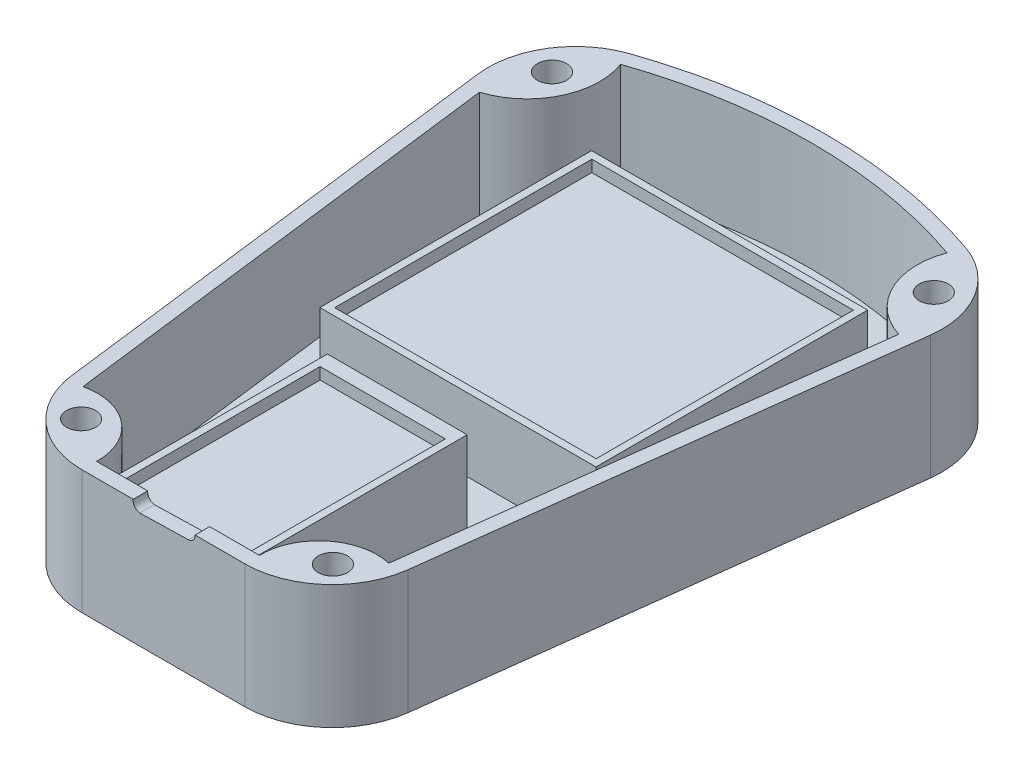
from build123d import *

# Parameters (mm, degrees)
BOSS_EXTRUDE1_DEPTH = 15
SHELL1_T            = 2
BOSS_EXTRUDE2_DEPTH = 15
SKETCH4_R           = 2
CUT_EXTRUDE3_DEPTH  = 17
SKETCH5_W           = 37.9
SKETCH5_H           = 37.3
BOSS_EXTRUDE3_DEPTH = 10
SKETCH8_W           = 35.9
SKETCH8_H           = 35.3
CUT_EXTRUDE4_DEPTH  = 1.6
SKETCH9_W           = 19.2
SKETCH9_H           = 30
BOSS_EXTRUDE5_DEPTH = 13.6
SKETCH11_W          = 17.2
SKETCH11_H          = 28
CUT_EXTRUDE7_DEPTH  = 1.6
CUT_EXTRUDE8_DEPTH  = 2


# Read off the part's stored shape, not the designer's step: Boss-Extrude2
with BuildPart() as part:
    # Sketch2 → Boss-Extrude1 (new body)
    with BuildSketch(Plane(origin=(0, 0, 0), x_dir=(1, 0, 0), z_dir=(0, 1, 0))):
        with BuildLine():
            Line((-29.057488174, 43.856363161), (-21.094956582, -19.84388958))
            ThreePointArc((-21.094956582, -19.84388958), (-17.790203447, -26.100323992), (-11.172177815, -28.603542234))
            Line((-11.172177815, -28.603542234), (11.172177815, -28.603542234))
            ThreePointArc((11.172177815, -28.603542234), (17.790203447, -26.100323992), (21.094956582, -19.84388958))
            Line((21.094956582, -19.84388958), (29.057488174, 43.856363161))
            ThreePointArc((29.057488174, 43.856363161), (27.625040268, 50.380107319), (22.404958564, 54.546867672))
            ThreePointArc((22.404958564, 54.546867672), (0, 58.313921904), (-22.404958564, 54.546867672))
            ThreePointArc((-22.404958564, 54.546867672), (-27.625040268, 50.380107319), (-29.057488174, 43.856363161))
        make_face()
    extrude(amount=BOSS_EXTRUDE1_DEPTH)

    # Shell1
    shell1_openings = [part.faces().sort_by_distance(p)[0] for p in [
        (0, 15, -16.825507136),
    ]]
    offset(amount=SHELL1_T, openings=shell1_openings, kind=Kind.INTERSECTION)

    # Boss-Extrude2 outline → Boss-Extrude2 (add)
    with BuildSketch(Plane(origin=(0, 0, 0), x_dir=(1, 0, 0), z_dir=(0, 1, 0))):
        with BuildLine():
            ThreePointArc((11.172177815, -28.603542234), (17.478052637, -26.364724021), (20.960385979, -20.65073078))
            ThreePointArc((20.960385979, -20.65073078), (14.125965093, -22.239021953), (11.172177815, -28.603542234))
        make_face()
        with BuildLine():
            ThreePointArc((22.404958564, 54.546867672), (22.805580573, 46.686663567), (28.769287815, 41.550760286))
            Line((28.769287815, 41.550760286), (29.057488174, 43.856363161))
            ThreePointArc((29.057488174, 43.856363161), (27.625040268, 50.380107319), (22.404958564, 54.546867672))
        make_face()
        with BuildLine():
            ThreePointArc((-11.172177815, -28.603542234), (-14.125965093, -22.239021953), (-20.960385978, -20.65073078))
            ThreePointArc((-20.960385978, -20.65073078), (-17.478052637, -26.364724021), (-11.172177815, -28.603542234))
        make_face()
        with BuildLine():
            Line((-29.057488174, 43.856363161), (-28.769287815, 41.550760286))
            ThreePointArc((-28.769287815, 41.550760286), (-22.805580573, 46.686663567), (-22.404958564, 54.546867672))
            ThreePointArc((-22.404958564, 54.546867672), (-27.625040268, 50.380107319), (-29.057488174, 43.856363161))
        make_face()
    extrude(amount=BOSS_EXTRUDE2_DEPTH)

    # Sketch4 → Cut-Extrude3 (cut)
    with BuildSketch(Plane(origin=(0, 15, 0), x_dir=(1, 0, 0), z_dir=(0, 1, 0))):
        with Locations(Location((-26.203765036, 48.932847943, 0), (0, 0, 270))):
            Circle(SKETCH4_R)
        with Locations(Location((-17.279655559, -24.618760567, 0), (0, 0, 270))):
            Circle(SKETCH4_R)
        with Locations(Location((17.279655559, -24.618760567, 0), (0, 0, 270))):
            Circle(SKETCH4_R)
        with Locations(Location((26.203765036, 48.932847943, 0), (0, 0, 270))):
            Circle(SKETCH4_R)
    extrude(amount=-CUT_EXTRUDE3_DEPTH, mode=Mode.SUBTRACT)

    # Sketch5 → Boss-Extrude3 (add)
    with BuildSketch(Plane(origin=(-2.134010057, 0, 0), x_dir=(1, 0, 0), z_dir=(0, 1, 0))):
        with Locations((1.95, 28.65)):
            Rectangle(SKETCH5_W, SKETCH5_H)
    extrude(amount=BOSS_EXTRUDE3_DEPTH)

    # Sketch8 → Cut-Extrude4 (cut)
    with BuildSketch(Plane(origin=(48.898344446, 10, 0), x_dir=(1, 0, 0), z_dir=(0, 1, 0))):
        with Locations((-49.05, 28.65)):
            Rectangle(SKETCH8_W, SKETCH8_H)
    extrude(amount=-CUT_EXTRUDE4_DEPTH, mode=Mode.SUBTRACT)

    # Sketch9 → Boss-Extrude5 (add)
    with BuildSketch(Plane(origin=(0, 0, 0), x_dir=(1, 0, 0), z_dir=(0, 1, 0))):
        with Locations((0.1, -13.603542234)):
            Rectangle(SKETCH9_W, SKETCH9_H)
    extrude(amount=BOSS_EXTRUDE5_DEPTH)

    # Sketch11 → Cut-Extrude7 (cut)
    with BuildSketch(Plane(origin=(0, 13.6, 0), x_dir=(1, 0, 0), z_dir=(0, 1, 0))):
        with Locations((0.1, -14.603542234)):
            Rectangle(SKETCH11_W, SKETCH11_H)
    extrude(amount=-CUT_EXTRUDE7_DEPTH, mode=Mode.SUBTRACT)

    # Sketch12 → Cut-Extrude8 (cut)
    with BuildSketch(Plane.XY.offset(30.603542234)):
        with BuildLine():
            Line((-4.15, 15), (4.35, 15))
            ThreePointArc((4.35, 15), (4.110077828, 14.306431155), (3.45, 13.985654515))
            Line((3.45, 13.985654515), (-3.25, 13.821910042))
            ThreePointArc((-3.25, 13.821910042), (-3.943990419, 14.224558918), (-4.15, 15))
        make_face()
    extrude(amount=-CUT_EXTRUDE8_DEPTH, mode=Mode.SUBTRACT)


solid = part.part
